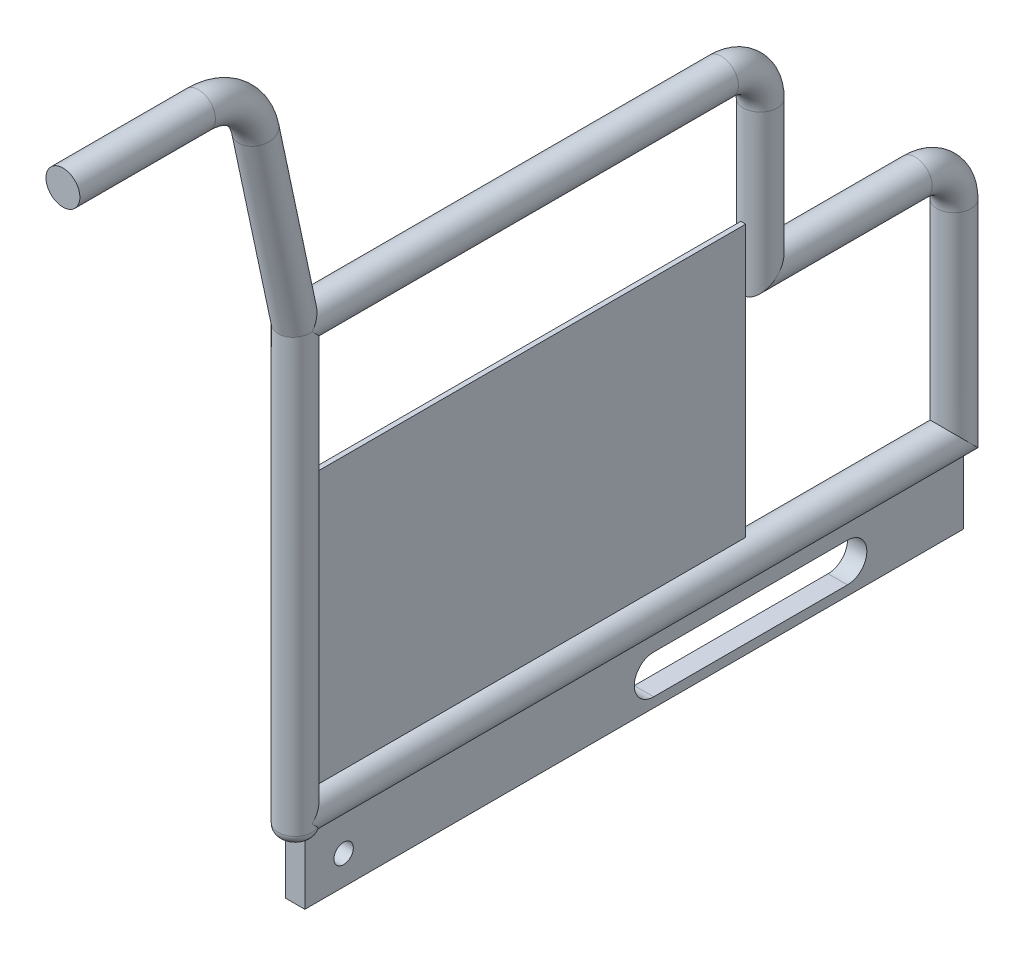
from build123d import *
from build123d.topology import SkipClean

# Parameters (mm, degrees)
SKETCH13_R          = 11.1125
SKETCH13_2_R        = 11.1125
SKETCH18_W          = 431.8
SKETCH18_H          = 50.8
SKETCH18_R          = 6.35
BOSS_EXTRUDE2_DEPTH = 6.35
SKETCH19_W          = 282.575
SKETCH19_H          = 177.8
BOSS_EXTRUDE3_DEPTH = 1.5875


with BuildPart() as part:
    # Sweep1: sweep along a path in Sketch1
    with BuildLine(Plane(origin=(0, 0, 0), x_dir=(0, 0, -1), z_dir=(1, 0, 0))) as sweep1_path:
        Line((152.212779539, -431.8), (584.012779539, -431.8))
        Line((584.012779539, -431.8), (584.012779539, -298.45))
        ThreePointArc((584.012779539, -298.45), (576.573291781, -280.489487758), (558.612779539, -273.05))
        Line((558.612779539, -273.05), (457.012779539, -273.05))
        Line((457.012779539, -273.05), (457.012779539, -177.8))
        ThreePointArc((457.012779539, -177.8), (449.573291781, -159.839487758), (431.612779539, -152.4))
        Line((431.612779539, -152.4), (152.212779539, -152.4))
        Line((152.212779539, -152.4), (126.163302593, -30.159201558))
        ThreePointArc((126.163302593, -30.159201558), (112.869413628, -8.484510635), (88.9, 0))
        Line((88.9, 0), (0, 0))
    # Sketch13 → Sweep1 (sweep)
    with BuildSketch(Plane.XY):
        Circle(SKETCH13_R)
    sweep(path=sweep1_path.line, transition=Transition.RIGHT)

    # Sweep2: sweep along a path in Sketch1<25>
    with BuildLine(Plane(origin=(0, 0, 0), x_dir=(0, 0, -1), z_dir=(1, 0, 0))) as sweep2_path:
        Line((0, 0), (88.9, 0))
        ThreePointArc((88.9, 0), (112.869413628, -8.484510635), (126.163302593, -30.159201558))
        Line((126.163302593, -30.159201558), (152.212779539, -152.4))
        Line((152.212779539, -152.4), (152.212779539, -431.8))
    # Sketch13<2> → Sweep2 (sweep)
    with BuildSketch(Plane.XY):
        Circle(SKETCH13_2_R)
    sweep(path=sweep2_path.line, transition=Transition.RIGHT)

    # Sketch17 → Revolve1 (revolve)
    with SkipClean():  # the faces are left unmerged after this step: merging them gives an invalid solid
        with BuildSketch(Plane(origin=(0, 0, 0), x_dir=(0, 0, -1), z_dir=(1, 0, 0))):
            with BuildLine():
                Line((152.212779539, -442.9125), (147.450279539, -442.9125))
                ThreePointArc((147.450279539, -442.9125), (142.960151479, -441.052628061), (141.100279539, -436.5625))
                Line((141.100279539, -436.5625), (141.100279539, -431.8))
                Line((141.100279539, -431.8), (152.212779539, -431.8))
                Line((152.212779539, -431.8), (152.212779539, -442.9125))
            make_face()
        revolve(axis=Axis((0, -698.5, -152.212779539), (0, 1, 0)))

    # Sketch18 → Boss-Extrude2 (add, symmetric)
    with SkipClean():  # the faces are left unmerged after this step: merging them gives an invalid solid
        with BuildSketch(Plane(origin=(0, 0, 0), x_dir=(0, 0, -1), z_dir=(1, 0, 0))):
            with Locations((368.112779539, -457.2)):
                Rectangle(SKETCH18_W, SKETCH18_H)
            with Locations((177.612779539, -463.55)):
                Circle(SKETCH18_R, mode=Mode.SUBTRACT)
            with BuildLine():
                Line((507.812779539, -476.25), (380.812779539, -476.25))
                ThreePointArc((380.812779539, -476.25), (368.112779539, -463.55), (380.812779539, -450.85))
                Line((380.812779539, -450.85), (507.812779539, -450.85))
                ThreePointArc((507.812779539, -450.85), (520.512779539, -463.55), (507.812779539, -476.25))
            make_face(mode=Mode.SUBTRACT)
        extrude(amount=BOSS_EXTRUDE2_DEPTH, both=True)


with BuildPart() as body_2:
    # Sketch19 → Boss-Extrude3 (new, symmetric)
    with BuildSketch(Plane(origin=(0, 0, 0), x_dir=(0, 0, -1), z_dir=(1, 0, 0))):
        with Locations((304.612779539, -331.7875)):
            Rectangle(SKETCH19_W, SKETCH19_H)
    extrude(amount=BOSS_EXTRUDE3_DEPTH, both=True)


solid = Compound([part.part, body_2.part])
